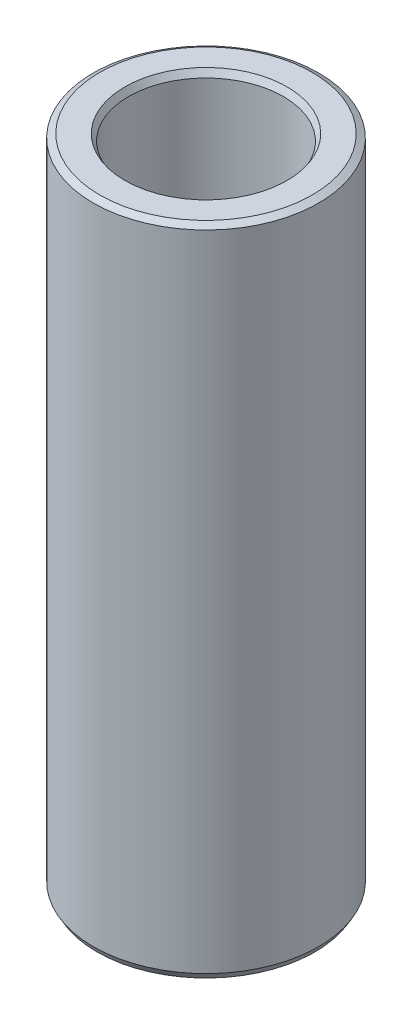
from build123d import *
from OCP.BRepFilletAPI import BRepFilletAPI_MakeChamfer

# Parameters (mm, degrees)
SKETCH1_R           = 7.5
BOSS_EXTRUDE1_DEPTH = 43.533382453
SKETCH2_R           = 5.150321519
CUT_EXTRUDE1_DEPTH  = 45.806867641
CHAMFER1_SIZE       = 0.248715435
CHAMFER1_SIZE2      = 0.430787771


with BuildPart() as part:
    # Sketch1 → Boss-Extrude1 (new body)
    with BuildSketch(Plane(origin=(0, 0, 0), x_dir=(1, 0, 0), z_dir=(0, 1, 0))):
        Circle(SKETCH1_R)
    extrude(amount=BOSS_EXTRUDE1_DEPTH)

    # Sketch2 → Cut-Extrude1 (cut, through all)
    with BuildSketch(Plane(origin=(0, 0, 0), x_dir=(1, 0, 0), z_dir=(0, 1, 0))):
        Circle(SKETCH2_R)
    extrude(amount=CUT_EXTRUDE1_DEPTH, mode=Mode.SUBTRACT)

    # Chamfer1: one chamfer whose edges measure the first distance from different faces: ONE call of the kernel's chamfer builder (chamfer() names one face for all edges)
    chamfer1_edges_1 = [part.edges().sort_by_distance(p)[0] for p in [
        (-5.150321519, 43.533382453, 0),
    ]]
    chamfer1_side_1 = [part.faces().sort_by_distance(p)[0] for p in [
        (-7.287867966, 43.533382453, 0),
    ]]
    chamfer1_edges_2 = [part.edges().sort_by_distance(p)[0] for p in [
        (-5.150321519, 0, 0),
    ]]
    chamfer1_side_2 = [part.faces().sort_by_distance(p)[0] for p in [
        (-5.150321519, 21.766691226, 0),
    ]]
    chamfer1_edges_3 = [part.edges().sort_by_distance(p)[0] for p in [
        (-7.5, 0, 0),
    ]]
    chamfer1_side_3 = [part.faces().sort_by_distance(p)[0] for p in [
        (-7.287867966, 0, 0),
    ]]
    chamfer1_edges_4 = [part.edges().sort_by_distance(p)[0] for p in [
        (-7.5, 43.533382453, 0),
    ]]
    chamfer1_side_4 = [part.faces().sort_by_distance(p)[0] for p in [
        (-7.5, 21.766691226, 0),
    ]]
    chamfer1 = BRepFilletAPI_MakeChamfer(part.part.solid().wrapped)
    for e in chamfer1_edges_1:
        chamfer1.Add(CHAMFER1_SIZE, CHAMFER1_SIZE2, e.wrapped, chamfer1_side_1[0].wrapped)  # the first distance lies on this face
    for e in chamfer1_edges_2:
        chamfer1.Add(CHAMFER1_SIZE, CHAMFER1_SIZE2, e.wrapped, chamfer1_side_2[0].wrapped)  # the first distance lies on this face
    for e in chamfer1_edges_3:
        chamfer1.Add(CHAMFER1_SIZE, CHAMFER1_SIZE2, e.wrapped, chamfer1_side_3[0].wrapped)  # the first distance lies on this face
    for e in chamfer1_edges_4:
        chamfer1.Add(CHAMFER1_SIZE, CHAMFER1_SIZE2, e.wrapped, chamfer1_side_4[0].wrapped)  # the first distance lies on this face
    add(Compound.cast(chamfer1.Shape()), mode=Mode.REPLACE)


solid = part.part
